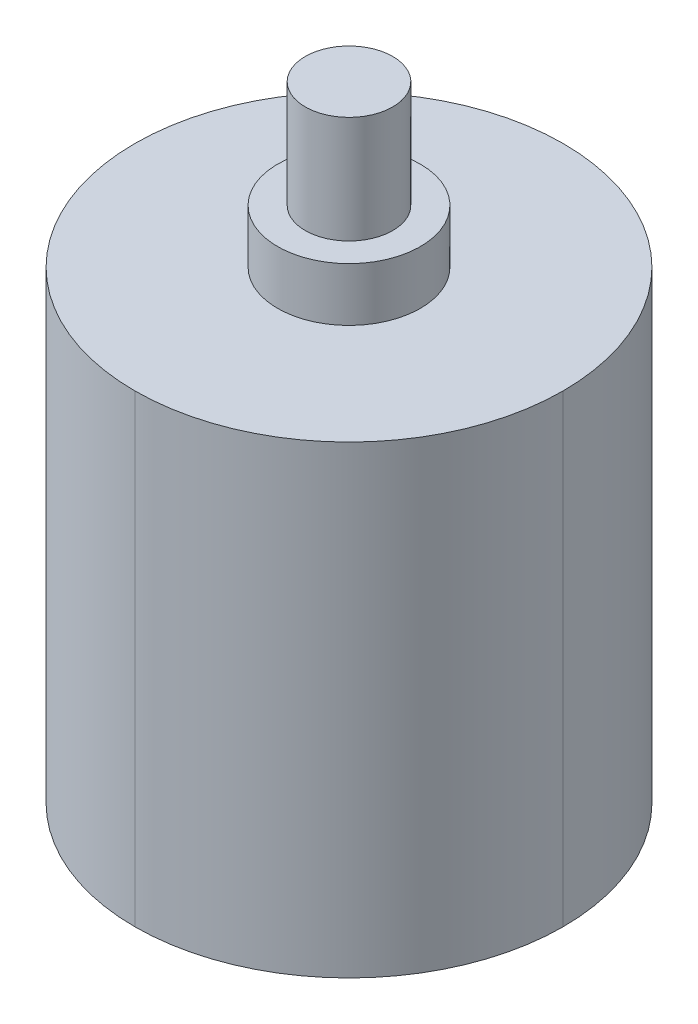
from build123d import *

# Parameters (mm, degrees)
SKETCH3_W           = 30.48
SKETCH3_H           = 30.48
BOSS_EXTRUDE1_DEPTH = 33.02
SKETCH4_R           = 5.08
BOSS_EXTRUDE2_DEPTH = 3.81
SKETCH5_R           = 3.1115
BOSS_EXTRUDE3_DEPTH = 7.62
SKETCH6_R           = 10.8585
CUT_EXTRUDE1_DEPTH  = 25.4
FILLET1_R           = 15.24


with BuildPart() as part:
    # Sketch3 → Boss-Extrude1 (new body)
    with BuildSketch(Plane(origin=(0, 0, 0), x_dir=(1, 0, 0), z_dir=(0, 1, 0))):
        with Locations((-15.24, 15.24)):
            Rectangle(SKETCH3_W, SKETCH3_H)
    extrude(amount=BOSS_EXTRUDE1_DEPTH)

    # Sketch4 → Boss-Extrude2 (add)
    with BuildSketch(Plane(origin=(0, 33.02, 0), x_dir=(1, 0, 0), z_dir=(0, 1, 0))):
        with Locations(Location((-15.24, 15.24, 0), (0, 0, 90))):
            Circle(SKETCH4_R)
    extrude(amount=BOSS_EXTRUDE2_DEPTH)

    # Sketch5 → Boss-Extrude3 (add)
    with BuildSketch(Plane(origin=(0, 36.83, 0), x_dir=(1, 0, 0), z_dir=(0, 1, 0))):
        with Locations(Location((-15.24, 15.24, 0), (0, 0, 90))):
            Circle(SKETCH5_R)
    extrude(amount=BOSS_EXTRUDE3_DEPTH)

    # Sketch6 → Cut-Extrude1 (cut)
    with BuildSketch(Plane.XZ):
        with Locations(Location((-15.24, -15.24, 0), (0, 0, 270))):
            Circle(SKETCH6_R)
    extrude(amount=-CUT_EXTRUDE1_DEPTH, mode=Mode.SUBTRACT)

    # Fillet1
    fillet1_edges = [part.edges().sort_by_distance(p)[0] for p in [
        (-30.48, 16.51, -30.48),
        (0, 16.51, -30.48),
        (-30.48, 16.51, 0),
        (0, 16.51, 0),
    ]]
    fillet(fillet1_edges, radius=FILLET1_R - 0.0001)  # a hair under: the kernel refuses the full size


solid = part.part
